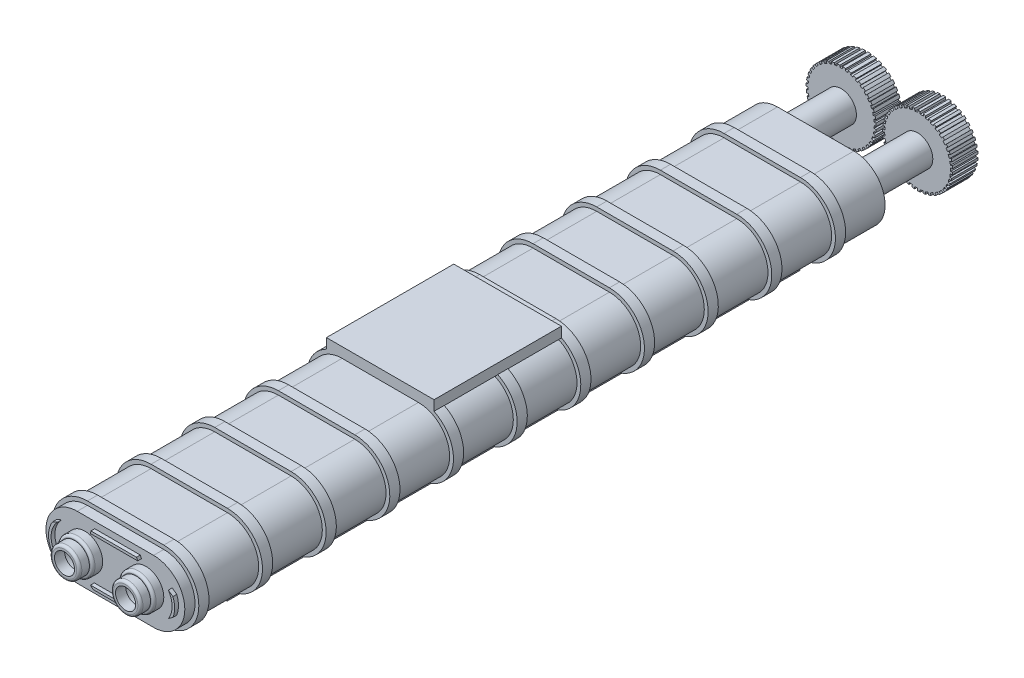
from build123d import *

# Parameters (mm, degrees)
BOSS_EXTRUDE2_DEPTH    = 275
BOSS_EXTRUDE3_DEPTH    = 225
SKETCH5_R              = 11.971196375
BOSS_EXTRUDE4_DEPTH    = 50
SKETCH6_R              = 27.5
BOSS_EXTRUDE5_DEPTH    = 20
SKETCH7_W              = 2.404329579
SKETCH7_H              = 3.36319587
CUT_EXTRUDE1_DEPTH     = 20
CIRPATTERN1_COUNT      = 39
SKETCH8_W              = 2
SKETCH8_H              = 3
CUT_EXTRUDE2_DEPTH     = 20
CIRPATTERN2_COUNT      = 39
BOSS_EXTRUDE8_START    = -8
BOSS_EXTRUDE8_DEPTH    = 8
LPATTERN2_COUNT        = 11
LPATTERN2_PITCH        = 50
BOSS_EXTRUDE9_DEPTH    = 3
SKETCH12_R             = 14
SKETCH12_R_2           = 11.61809049
BOSS_EXTRUDE10_DEPTH   = 8
SKETCH13_R             = 11.61809049
SKETCH13_R_2           = 7.89743956
BOSS_EXTRUDE11_DEPTH   = 8
BOSS_EXTRUDE11_2_DEPTH = 8
FILLET3_R              = 2
FILLET4_R              = 2
FILLET5_R              = 2
SKETCH14_W             = 84.514129808
SKETCH14_H             = 100
BOSS_EXTRUDE12_DEPTH   = 8


with BuildPart() as part:
    # Sketch1 → Boss-Extrude2 (new, symmetric)
    with BuildSketch(Plane.XY):
        with BuildLine():
            Line((-20, 24.514129808), (40, 24.514129808))
            ThreePointArc((40, 24.514129808), (64.514129808, 0), (40, -24.514129808))
            Line((40, -24.514129808), (-20, -24.514129808))
            ThreePointArc((-20, -24.514129808), (-44.514129808, 0), (-20, 24.514129808))
        make_face()
    extrude(amount=BOSS_EXTRUDE2_DEPTH, both=True)

    # Sketch4 → Boss-Extrude3 (add, symmetric)
    with BuildSketch(Plane.XY):
        Polygon((27.699188468, -24.33430646), (47.681665232, -24.33430646), (47.681665232, -27.83430646), (27.699188468, -27.83430646), (-27.158716498, -27.83430646), (-27.158716498, -24.33430646), align=None)
    extrude(amount=BOSS_EXTRUDE3_DEPTH, both=True)

    # Sketch5 → Boss-Extrude4 (add)
    with BuildSketch(Plane(origin=(0, 0, -275), x_dir=(-1, 0, 0), z_dir=(0, 0, -1))):
        with Locations(Location((-40, 0, 0), (0, 0, 180))):
            Circle(SKETCH5_R)
        with Locations(Location((20, 0, 0), (0, 0, 180))):
            Circle(SKETCH5_R)
    extrude(amount=BOSS_EXTRUDE4_DEPTH)

    # Sketch6 → Boss-Extrude5 (add)
    with BuildSketch(Plane(origin=(0, 0, -325), x_dir=(-1, 0, 0), z_dir=(0, 0, -1))):
        with Locations((-40, 0)):
            Circle(SKETCH6_R)
        with Locations((20, 0)):
            Circle(SKETCH6_R)
    extrude(amount=BOSS_EXTRUDE5_DEPTH)

    # Sketch7 → Cut-Extrude1 (cut)
    with BuildSketch(Plane(origin=(0, 0, -345), x_dir=(-1, 0, 0), z_dir=(0, 0, -1))):
        with Locations((-43.300729713, 27.301193808)):
            Rectangle(SKETCH7_W, SKETCH7_H)
    cut_extrude1 = extrude(amount=-CUT_EXTRUDE1_DEPTH, mode=Mode.SUBTRACT)

    # CirPattern1: Cut-Extrude1 ×39 about axis
    cirpattern1_axis = Axis((40, 0, 0), (0, 0, 1))
    for i in range(1, CIRPATTERN1_COUNT):
        add(cut_extrude1.rotate(cirpattern1_axis, i * 360 / CIRPATTERN1_COUNT), mode=Mode.SUBTRACT)

    # Sketch8 → Cut-Extrude2 (cut)
    with BuildSketch(Plane(origin=(0, 0, -345), x_dir=(-1, 0, 0), z_dir=(0, 0, -1))):
        with Locations((20, 27.5)):
            Rectangle(SKETCH8_W, SKETCH8_H)
    cut_extrude2 = extrude(amount=-CUT_EXTRUDE2_DEPTH, mode=Mode.SUBTRACT)

    # CirPattern2: Cut-Extrude2 ×39 about axis
    cirpattern2_axis = Axis((-20, 0, 0), (0, 0, 1))
    for i in range(1, CIRPATTERN2_COUNT):
        add(cut_extrude2.rotate(cirpattern2_axis, i * 360 / CIRPATTERN2_COUNT), mode=Mode.SUBTRACT)

    # Sketch10 → Boss-Extrude8 (add)
    with BuildSketch(Plane.XY.offset(275).offset(BOSS_EXTRUDE8_START)):
        with BuildLine():
            Line((-20, -27.514129808), (40, -27.514129808))
            ThreePointArc((40, -27.514129808), (67.514129808, 0), (40, 27.514129808))
            Line((40, 27.514129808), (-20, 27.514129808))
            ThreePointArc((-20, 27.514129808), (-47.514129808, 0), (-20, -27.514129808))
        make_face()
        with BuildLine():
            Line((-20, -24.514129808), (40, -24.514129808))
            ThreePointArc((40, -24.514129808), (64.514129808, 0), (40, 24.514129808))
            Line((40, 24.514129808), (-20, 24.514129808))
            ThreePointArc((-20, 24.514129808), (-44.514129808, 0), (-20, -24.514129808))
        make_face(mode=Mode.SUBTRACT)
    boss_extrude8 = extrude(amount=-BOSS_EXTRUDE8_DEPTH)

    # LPattern2: Boss-Extrude8 ×11
    with Locations(*[(0, 0, -i * LPATTERN2_PITCH) for i in range(1, LPATTERN2_COUNT)]):
        add(boss_extrude8)

    # Sketch11 → Boss-Extrude9 (add)
    with BuildSketch(Plane.XY.offset(275)):
        Polygon((-4.584922822, -19.514129808), (28.545531042, -19.514129808), (30.545531042, -17.514129808), (-6.584922822, -17.514129808), align=None)
        Polygon((29.543355044, 19.514129808), (-6.235766552, 19.514129808), (-6.584922822, 17.514129808), (30.545531042, 17.514129808), align=None)
        with BuildLine():
            Line((-36.405160307, 10.567496271), (-32.097719805, 12.664514142))
            ThreePointArc((-32.097719805, 12.664514142), (-37.514129808, 0), (-32.097719805, -12.664514142))
            Line((-32.097719805, -12.664514142), (-36.405160307, -10.567496271))
            ThreePointArc((-36.405160307, -10.567496271), (-39.514129808, 0), (-36.405160307, 10.567496271))
        make_face()
        with BuildLine():
            Line((58.181503587, 7.087608164), (54.601310864, 9.671942099))
            ThreePointArc((54.601310864, 9.671942099), (57.514129808, 0), (54.601310864, -9.671942099))
            Line((54.601310864, -9.671942099), (58.181503587, -7.087608164))
            ThreePointArc((58.181503587, -7.087608164), (59.514129808, 0), (58.181503587, 7.087608164))
        make_face()
    extrude(amount=BOSS_EXTRUDE9_DEPTH)

    # Sketch12 → Boss-Extrude10 (add)
    # profile 1 of 2: a face of its own
    with BuildSketch(Plane.XY.offset(275)):
        with Locations((-14, 0)):
            Circle(SKETCH12_R)
        with Locations((-14, 0)):
            Circle(SKETCH12_R_2, mode=Mode.SUBTRACT)
    # profile 2 of 2: a face of its own
    with BuildSketch(Plane.XY.offset(275)):
        with Locations((34, 0)):
            Circle(SKETCH12_R)
        with Locations((34, 0)):
            Circle(SKETCH12_R_2, mode=Mode.SUBTRACT)
    extrude(amount=BOSS_EXTRUDE10_DEPTH)

    # Fillet3
    fillet3_edges = [part.edges().sort_by_distance(p)[0] for p in [
        (-28, 0, 283),
        (20, 0, 283),
    ]]
    fillet(fillet3_edges, radius=FILLET3_R)

    # Sketch14 → Boss-Extrude12 (add)
    with BuildSketch(Plane(origin=(0, 24.514129808, 0), x_dir=(1, 0, 0), z_dir=(0, 1, 0))):
        with Locations((10, -17)):
            Rectangle(SKETCH14_W, SKETCH14_H)
    extrude(amount=BOSS_EXTRUDE12_DEPTH)


with BuildPart() as body_2:
    # Sketch13 → Boss-Extrude11 (new body)
    with BuildSketch(Plane.XY.offset(283)):
        with Locations((-14, 0)):
            Circle(SKETCH13_R)
        with Locations((-14, 0)):
            Circle(SKETCH13_R_2, mode=Mode.SUBTRACT)
    extrude(amount=BOSS_EXTRUDE11_DEPTH)

    # Fillet5
    fillet5_edges = [body_2.edges().sort_by_distance(p)[0] for p in [
        (-25.61809049, 0, 291),
    ]]
    fillet(fillet5_edges, radius=FILLET5_R)


with BuildPart() as body_3:
    # Sketch13 → Boss-Extrude11 2 (new body)
    with BuildSketch(Plane.XY.offset(283)):
        with Locations((34, 0)):
            Circle(SKETCH13_R)
        with Locations((34, 0)):
            Circle(SKETCH13_R_2, mode=Mode.SUBTRACT)
    extrude(amount=BOSS_EXTRUDE11_2_DEPTH)

    # Fillet4
    fillet4_edges = [body_3.edges().sort_by_distance(p)[0] for p in [
        (22.38190951, 0, 291),
    ]]
    fillet(fillet4_edges, radius=FILLET4_R)


solid = Compound([part.part, body_2.part, body_3.part])
